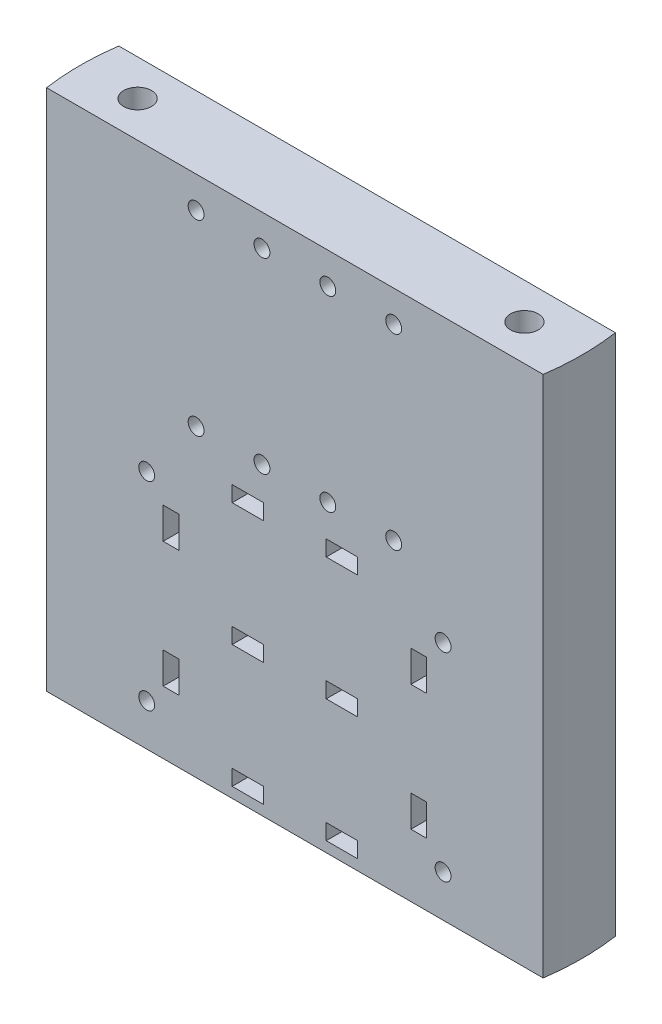
from build123d import *

# Parameters (mm, degrees)
BOSS_EXTRUDE1_DEPTH           = 127
TAP_DRILL_FOR_1_4_HELICOIL1_D = 6.7564
F_8_CLEARANCE_HOLE1_D         = 3.8608
SKETCH19_W                    = 7.62
SKETCH19_H                    = 3.81
SKETCH19_W_2                  = 3.81
SKETCH19_H_2                  = 7.62
CUT_EXTRUDE3_DEPTH            = 142.961915668
F_8_CLEARANCE_HOLE2_D         = 3.8608
F_8_CLEARANCE_HOLE3_D         = 3.8608
SKETCH29_W                    = 80.01
SKETCH29_H                    = 63.5
CUT_EXTRUDE4_DEPTH            = 5.08


with BuildPart() as part:
    # Sketch1 → Boss-Extrude1 (new body)
    with BuildSketch(Plane(origin=(0, 0, 0), x_dir=(1, 0, 0), z_dir=(0, 1, 0))):
        with BuildLine():
            Line((60.325, 8.7758746), (-60.325, 8.7758746))
            ThreePointArc((-60.325, 8.7758746), (-60.96, 0), (-60.325, -8.7758746))
            Line((-60.325, -8.7758746), (60.325, -8.7758746))
            ThreePointArc((60.325, -8.7758746), (60.96, 0), (60.325, 8.7758746))
        make_face()
    extrude(amount=BOSS_EXTRUDE1_DEPTH)

    # Tap Drill for 1/4 Helicoil1 (through all)
    with Locations(Plane(origin=(0, 127, 0), x_dir=(1, 0, 0), z_dir=(0, 1, 0))):
        with Locations((-46.99, 0), (46.99, 0)):
            Hole(TAP_DRILL_FOR_1_4_HELICOIL1_D / 2)

    # #8 Clearance Hole1 (through all)
    with Locations(Plane(origin=(0, 0, -8.7758746), x_dir=(-1, 0, 0), z_dir=(0, 0, -1))):
        with Locations((-8.001, 119.38), (-8.001, 73.914), (8.001, 73.914), (8.001, 119.38)):
            Hole(F_8_CLEARANCE_HOLE1_D / 2)

    # Sketch19 → Cut-Extrude3 (cut, through all)
    with BuildSketch(Plane(origin=(0, 0, -8.7758746), x_dir=(-1, 0, 0), z_dir=(0, 0, -1))):
        with Locations((-11.43, 34.29)):
            Rectangle(SKETCH19_W, SKETCH19_H)
        with Locations((30.099, 49.53)):
            Rectangle(SKETCH19_W_2, SKETCH19_H_2)
        with Locations((-11.43, 64.135)):
            Rectangle(SKETCH19_W, SKETCH19_H)
        with Locations((11.43, 64.135)):
            Rectangle(SKETCH19_W, SKETCH19_H)
        with Locations((-11.43, 4.445)):
            Rectangle(SKETCH19_W, SKETCH19_H)
        with Locations((11.43, 4.445)):
            Rectangle(SKETCH19_W, SKETCH19_H)
        with Locations((-30.099, 49.53)):
            Rectangle(SKETCH19_W_2, SKETCH19_H_2)
        with Locations((30.099, 19.05)):
            Rectangle(SKETCH19_W_2, SKETCH19_H_2)
        with Locations((-30.099, 19.05)):
            Rectangle(SKETCH19_W_2, SKETCH19_H_2)
        with Locations((11.43, 34.29)):
            Rectangle(SKETCH19_W, SKETCH19_H)
    extrude(amount=-CUT_EXTRUDE3_DEPTH, mode=Mode.SUBTRACT)

    # #8 Clearance Hole2 (through all)
    with Locations(Plane(origin=(0, 0, -8.7758746), x_dir=(-1, 0, 0), z_dir=(0, 0, -1))):
        with Locations((-24.003, 119.38), (-24.003, 73.914), (24.003, 73.914), (24.003, 119.38)):
            Hole(F_8_CLEARANCE_HOLE2_D / 2)

    # #8 Clearance Hole3 (through all)
    with Locations(Plane(origin=(0, 0, -8.7758746), x_dir=(-1, 0, 0), z_dir=(0, 0, -1))):
        with Locations((-36.0045, 58.42), (-36.0045, 10.16), (36.0045, 10.16), (36.0045, 58.42)):
            Hole(F_8_CLEARANCE_HOLE3_D / 2)

    # Sketch29 → Cut-Extrude4 (cut)
    with BuildSketch(Plane(origin=(0, 0, -8.7758746), x_dir=(-1, 0, 0), z_dir=(0, 0, -1))):
        with Locations((0, 34.29)):
            Rectangle(SKETCH29_W, SKETCH29_H)
    extrude(amount=-CUT_EXTRUDE4_DEPTH, mode=Mode.SUBTRACT)


solid = part.part
